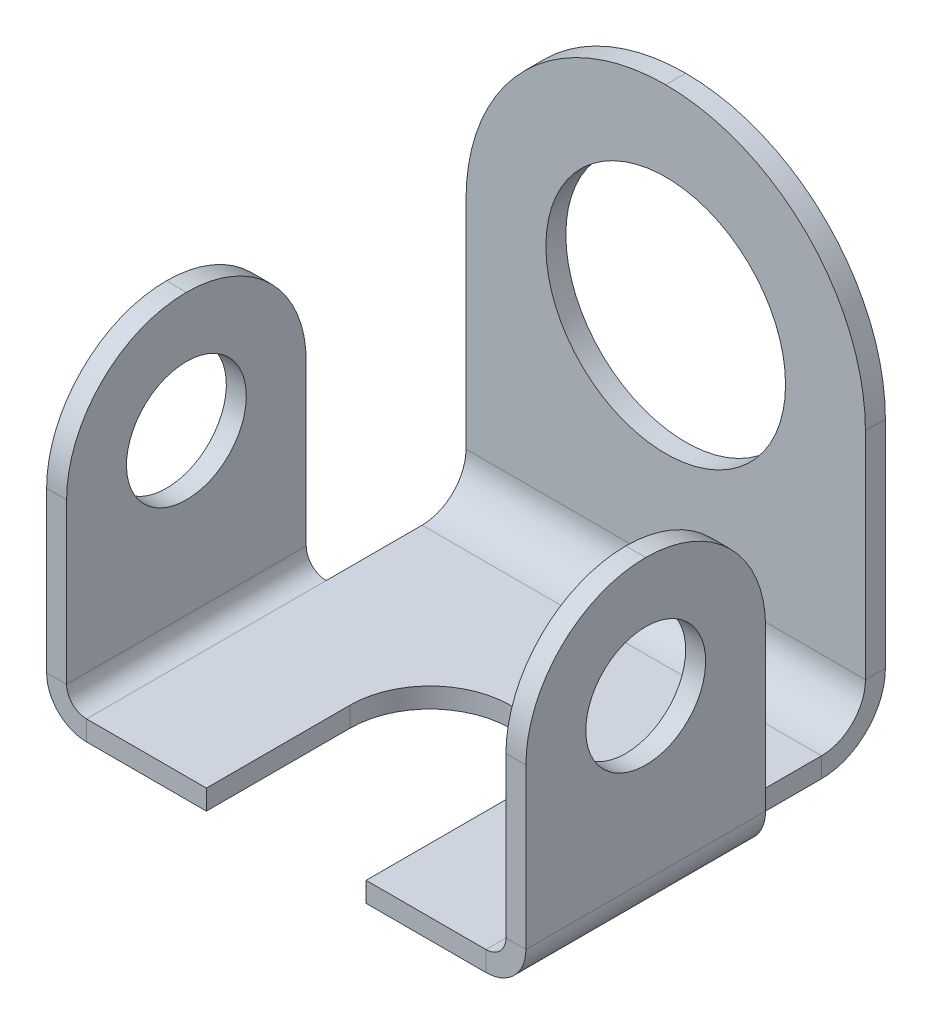
from build123d import *

# Parameters (mm, degrees)
SKETCH1_W                    = 50
SKETCH1_H                    = 50
BASE_FLANGE1_DEPTH           = 2.5
EDGE_FLANGE2_STRIP_W         = 21
EDGE_FLANGE2_STRIP_H         = 2.5
EDGE_FLANGE2_STRIP_CUT_DEPTH = 50
EDGE_FLANGE2_DEPTH           = 50
BREAK_CORNER2_START          = -25
BREAK_CORNER2_DEPTH          = 2.5
EDGE_FLANGE4_DEPTH           = 30
SKETCH29_R                   = 15
CUT_EXTRUDE1_DEPTH           = 10
CUT_EXTRUDE2_DEPTH           = 10
BREAK_CORNER3_START          = -30
BREAK_CORNER3_DEPTH          = 60
SKETCH31_R                   = 7.5
CUT_EXTRUDE3_DEPTH           = 72


# Read off the part's stored shape, not the designer's step: Break-Corner2, Break-Corner3
# Sheet-metal steps are written as plain solids
with BuildPart() as part:
    # Sketch1 → Base-Flange1 (new body)
    with BuildSketch(Plane(origin=(0, 0, 0), x_dir=(1, 0, 0), z_dir=(0, 1, 0))):
        Rectangle(SKETCH1_W, SKETCH1_H)
    extrude(amount=BASE_FLANGE1_DEPTH)

    # Edge-Flange2 strip (across the edge) → Edge-Flange2 strip cut (cut)
    with BuildSketch(Plane(origin=(25, 2.5, -25), x_dir=(0, 0, 1), z_dir=(-1, 0, 0))):
        with Locations((-2.5, -1.25)):
            Rectangle(EDGE_FLANGE2_STRIP_W, EDGE_FLANGE2_STRIP_H)
    extrude(amount=EDGE_FLANGE2_STRIP_CUT_DEPTH, mode=Mode.SUBTRACT)

    # Edge-Flange2 section (across the edge) → Edge-Flange2 (add)
    with BuildSketch(Plane(origin=(25, 2.5, -25), x_dir=(0, 0, 1), z_dir=(-1, 0, 0))):
        with BuildLine():
            Line((0, 5.5), (0, 57.5))
            Line((0, 57.5), (2.5, 57.5))
            Line((2.5, 57.5), (2.5, 5.5))
            ThreePointArc((2.5, 5.5), (4.110912703, 1.610912703), (8, 0))
            Line((8, 0), (8, -2.5))
            ThreePointArc((8, -2.5), (2.343145751, -0.156854249), (0, 5.5))
        make_face()
    extrude(amount=EDGE_FLANGE2_DEPTH)

    # Break-Corner2 outline → Break-Corner2 (cut)
    with BuildSketch(Plane.XY.offset(BREAK_CORNER2_START)):
        with BuildLine():
            ThreePointArc((-25, 35), (-17.67766953, 52.67766953), (0, 60))
            Line((0, 60), (-25, 60))
            Line((-25, 60), (-25, 35))
        make_face()
        with BuildLine():
            ThreePointArc((0, 60), (17.67766953, 52.67766953), (25, 35))
            Line((25, 35), (25, 60))
            Line((25, 60), (0, 60))
        make_face()
    extrude(amount=BREAK_CORNER2_DEPTH, mode=Mode.SUBTRACT)

    # Edge-Flange4 section (across the edge) → Edge-Flange4 (add)
    with BuildSketch(Plane(origin=(27.5, 2.5, 25), x_dir=(-1, 0, 0), z_dir=(0, 0, -1))):
        with BuildLine():
            Line((-2.5, 2.5), (-2.5, 37.5))
            Line((-2.5, 37.5), (0, 37.5))
            Line((0, 37.5), (0, 2.5))
            ThreePointArc((0, 2.5), (0.732233047, 0.732233047), (2.5, 0))
            Line((2.5, 0), (2.5, -2.5))
            ThreePointArc((2.5, -2.5), (-1.035533906, -1.035533906), (-2.5, 2.5))
        make_face()
    edge_flange4 = extrude(amount=EDGE_FLANGE4_DEPTH)

    # Mirror1: Edge-Flange4 across plane
    add(edge_flange4.mirror(Plane(origin=(0, 0, 0), x_dir=(0, 0, 1), z_dir=(1, 0, 0))))

    # Sketch29 → Cut-Extrude1 (cut)
    with BuildSketch(Plane.XY.offset(-22.5)):
        with Locations((0, 35)):
            Circle(SKETCH29_R)
    extrude(amount=-CUT_EXTRUDE1_DEPTH, mode=Mode.SUBTRACT)

    # Sketch30 → Cut-Extrude2 (cut)
    with BuildSketch(Plane(origin=(0, 2.5, 0), x_dir=(1, 0, 0), z_dir=(0, 1, 0))):
        with BuildLine():
            Line((-10, -43), (10, -43))
            Line((10, -43), (10, -7))
            ThreePointArc((10, -7), (0, 3), (-10, -7))
            Line((-10, -7), (-10, -43))
        make_face()
    extrude(amount=-CUT_EXTRUDE2_DEPTH, mode=Mode.SUBTRACT)

    # Break-Corner3 outline → Break-Corner3 (cut)
    with BuildSketch(Plane.YZ.offset(BREAK_CORNER3_START)):
        with BuildLine():
            Line((40, -5), (40, 10))
            ThreePointArc((40, 10), (35.606601718, -0.606601718), (25, -5))
            Line((25, -5), (40, -5))
        make_face()
        with BuildLine():
            ThreePointArc((25, 25), (35.606601718, 20.606601718), (40, 10))
            Line((40, 10), (40, 25))
            Line((40, 25), (25, 25))
        make_face()
    extrude(amount=BREAK_CORNER3_DEPTH, mode=Mode.SUBTRACT)

    # Sketch31 → Cut-Extrude3 (cut)
    with BuildSketch(Plane(origin=(30, 0, 0), x_dir=(0, 0, -1), z_dir=(1, 0, 0))):
        with Locations(Location((-10, 25, 0), (0, 0, 90))):
            Circle(SKETCH31_R)
    extrude(amount=-CUT_EXTRUDE3_DEPTH, mode=Mode.SUBTRACT)


solid = part.part
